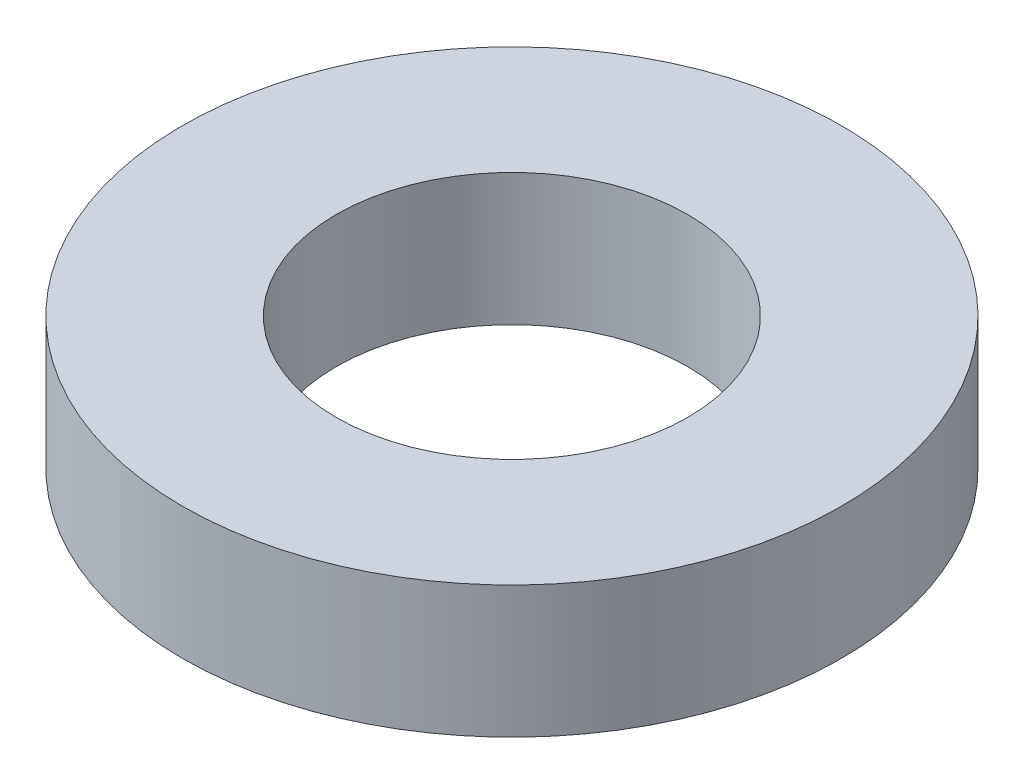
from build123d import *

# Parameters (mm, degrees)
SKETCH1_R           = 75
BOSS_EXTRUDE1_DEPTH = 30
SKETCH2_R           = 40
CUT_EXTRUDE1_DEPTH  = 111.227038425


with BuildPart() as part:
    # Sketch1 → Boss-Extrude1 (new body)
    with BuildSketch(Plane(origin=(0, 0, 0), x_dir=(1, 0, 0), z_dir=(0, 1, 0))):
        Circle(SKETCH1_R)
    extrude(amount=BOSS_EXTRUDE1_DEPTH)

    # Sketch2 → Cut-Extrude1 (cut, through all)
    with BuildSketch(Plane(origin=(0, 0, 0), x_dir=(1, 0, 0), z_dir=(0, 1, 0))):
        Circle(SKETCH2_R)
    extrude(amount=CUT_EXTRUDE1_DEPTH, mode=Mode.SUBTRACT)


solid = part.part
